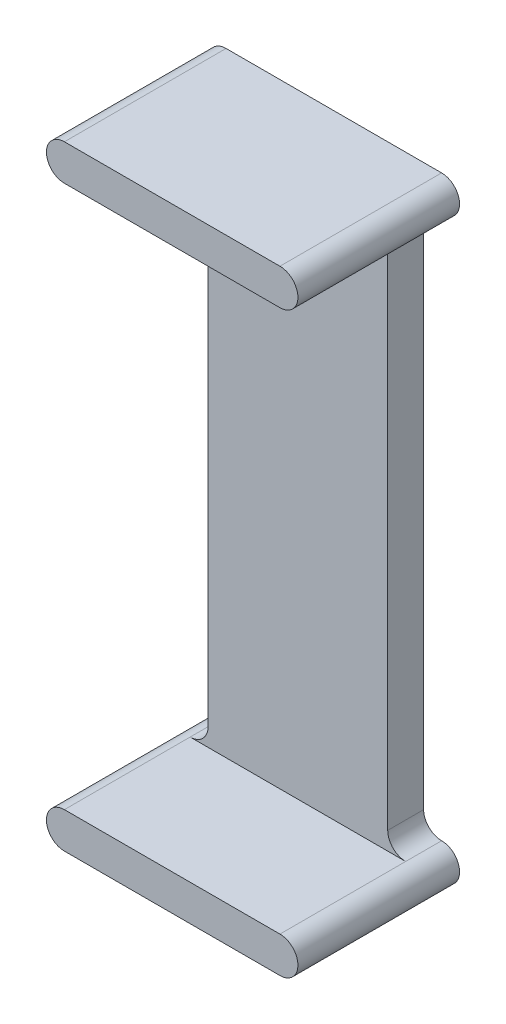
from build123d import *

# Parameters (mm, degrees)
BOSS_EXTRUDE3_DEPTH = 2
BOSS_EXTRUDE4_DEPTH = 7
FILLET2_R           = 1


with BuildPart() as part:
    # Sketch1 → Boss-Extrude3 (new body)
    with BuildSketch(Plane.XY):
        with BuildLine():
            Line((-5, 15.1), (-5, 0.9))
            Line((-5, 0.9), (-5, -1.1))
            Line((-5, -1.1), (-5, -15.1))
            Line((-5, -15.1), (-6, -15.1))
            ThreePointArc((-6, -15.1), (-7, -16.1), (-6, -17.1))
            Line((-6, -17.1), (5, -17.1))
            Line((5, -17.1), (6, -17.1))
            ThreePointArc((6, -17.1), (7, -16.1), (6, -15.1))
            Line((6, -15.1), (5, -15.1))
            Line((5, -15.1), (5, -1.1))
            Line((5, -1.1), (5, 0.9))
            Line((5, 0.9), (5, 15.1))
            Line((5, 15.1), (6, 15.1))
            ThreePointArc((6, 15.1), (7, 16.1), (6, 17.1))
            Line((6, 17.1), (5, 17.1))
            Line((5, 17.1), (-5, 17.1))
            Line((-5, 17.1), (-6, 17.1))
            ThreePointArc((-6, 17.1), (-7, 16.1), (-6, 15.1))
            Line((-6, 15.1), (-5, 15.1))
        make_face()
    extrude(amount=BOSS_EXTRUDE3_DEPTH)

    # Sketch3 → Boss-Extrude4 (add)
    with BuildSketch(Plane.XY.offset(2)):
        with BuildLine():
            Line((-6, 15.1), (-5, 15.1))
            Line((-5, 15.1), (5, 15.1))
            Line((5, 15.1), (6, 15.1))
            ThreePointArc((6, 15.1), (7, 16.1), (6, 17.1))
            Line((6, 17.1), (-6, 17.1))
            ThreePointArc((-6, 17.1), (-7, 16.1), (-6, 15.1))
        make_face()
        with BuildLine():
            Line((-6, -15.1), (-5, -15.1))
            Line((-5, -15.1), (5, -15.1))
            Line((5, -15.1), (6, -15.1))
            ThreePointArc((6, -15.1), (7, -16.1), (6, -17.1))
            Line((6, -17.1), (-6, -17.1))
            ThreePointArc((-6, -17.1), (-7, -16.1), (-6, -15.1))
        make_face()
    extrude(amount=BOSS_EXTRUDE4_DEPTH)

    # Fillet2
    fillet2_edges = [part.edges().sort_by_distance(p)[0] for p in [
        (-5, 15.1, 1),
        (-5, -15.1, 1),
        (5, 15.1, 1),
        (5, -15.1, 1),
    ]]
    fillet(fillet2_edges, radius=FILLET2_R - 0.0001)  # a hair under: the kernel refuses the full size


solid = part.part
